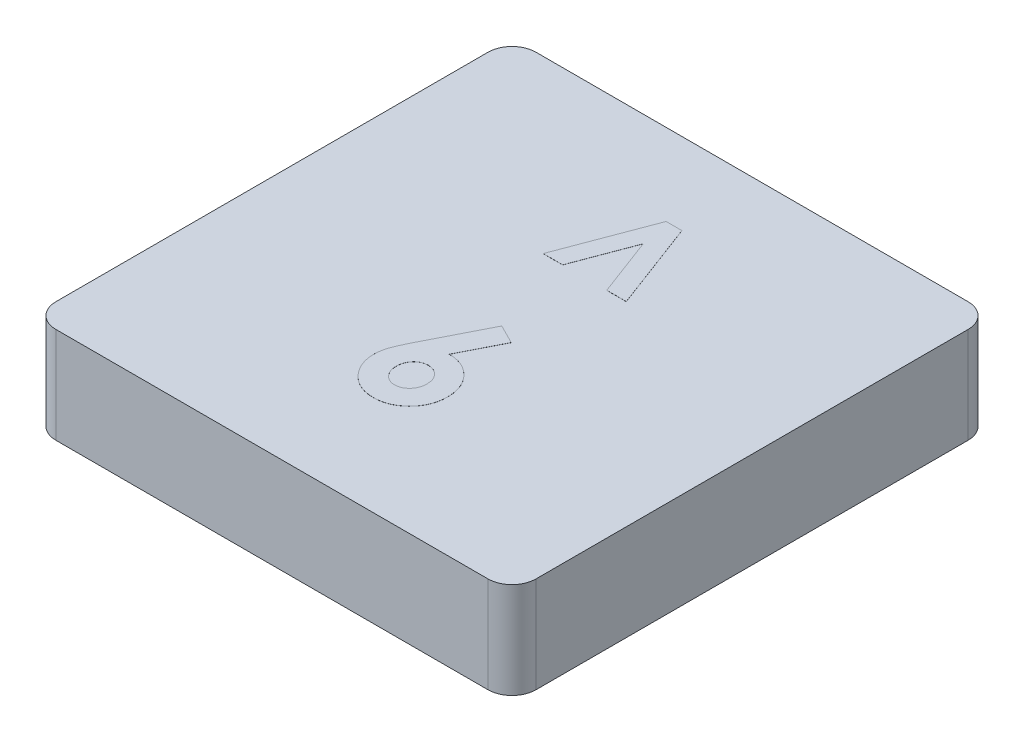
from build123d import *

# Parameters (mm, degrees)
SKETCH1_W           = 12.7
SKETCH1_H           = 12.7
BOSS_EXTRUDE1_DEPTH = 2.54
FILLET1_R           = 0.635
SHELL1_START        = 0.635
SHELL1_OUTLINE_W    = 1.905
SHELL1_OUTLINE_H    = 11.43
SHELL1_DEPTH        = 11.43
SKETCH2_R           = 2.54
BOSS_EXTRUDE2_DEPTH = 1.905
BOSS_EXTRUDE4_DEPTH = 0.00254


# Read off the part's stored shape, not the designer's step: Shell1
with BuildPart() as part:
    # Sketch1 → Boss-Extrude1 (new body)
    with BuildSketch(Plane(origin=(0, 0, 0), x_dir=(1, 0, 0), z_dir=(0, 1, 0))):
        with Locations((6.35, 6.35)):
            Rectangle(SKETCH1_W, SKETCH1_H)
    extrude(amount=BOSS_EXTRUDE1_DEPTH)

    # Fillet1
    fillet1_edges = [part.edges().sort_by_distance(p)[0] for p in [
        (0, 1.27, -12.7),
        (12.7, 1.27, -12.7),
        (12.7, 1.27, 0),
        (0, 1.27, 0),
    ]]
    fillet(fillet1_edges, radius=FILLET1_R)

    # Shell1 outline → Shell1 (cut)
    with BuildSketch(Plane.YZ.offset(SHELL1_START)):
        with Locations((0.9525, -6.35)):
            Rectangle(SHELL1_OUTLINE_W, SHELL1_OUTLINE_H)
    extrude(amount=SHELL1_DEPTH, mode=Mode.SUBTRACT)

    # Sketch2 → Boss-Extrude2 (add)
    with BuildSketch(Plane(origin=(0, 1.905, 0), x_dir=(-1, 0, 0), z_dir=(0, -1, 0))):
        with Locations(Location((-6.35, 6.35, 0), (0, 0, 270))):
            Circle(SKETCH2_R)
    extrude(amount=BOSS_EXTRUDE2_DEPTH)

    # Sketch4 → Boss-Extrude4 (add)
    # profile 1 of 2: a face of its own
    with BuildSketch(Plane(origin=(0, 2.54, 0), x_dir=(1, 0, 0), z_dir=(0, 1, 0))):
        with BuildLine():
            Line((6.456138622, 5.974210256), (6.960500601, 5.71853117))
            Line((6.960500601, 5.71853117), (6.407165264, 4.630941026))
            add(Edge.make_bspline(
                [(6.407165264, 4.630941026), (6.439855797, 4.630094651), (6.504245162, 4.628427578), (6.598981047, 4.614954014), (6.689550316, 4.591661453), (6.776866176, 4.560787227), (6.859861273, 4.519322834), (6.939872289, 4.469998775), (7.014829299, 4.40984278), (7.086451002, 4.34319313), (7.151576249, 4.269354895), (7.20814904, 4.190013367), (7.257451228, 4.107098934), (7.295776765, 4.018756598), (7.32669142, 3.926450736), (7.348997703, 3.82981236), (7.361724062, 3.728561626), (7.363478603, 3.659777417), (7.364371795, 3.624761138)],
                knots=[0, 0, 0, 0, 1.013260694, 1.995783107, 2.958651975, 3.908806537, 4.861209129, 5.829647963, 6.817170299, 7.835534541, 8.860094905, 9.863329007, 10.853101798, 11.844815043, 12.84250023, 13.867713965, 14.914507806, 16, 16, 16, 16], degree=3))
            add(Edge.make_bspline(
                [(7.364371795, 3.624761138), (7.3635348, 3.591007569), (7.361880421, 3.524291238), (7.348204784, 3.426301914), (7.326104237, 3.332286889), (7.294518118, 3.242433922), (7.254369605, 3.156303809), (7.205270694, 3.073947091), (7.146814203, 2.995979194), (7.080510488, 2.922814401), (7.008029089, 2.856124152), (6.931629747, 2.796845977), (6.850665063, 2.747879955), (6.766665364, 2.706527002), (6.678084165, 2.675668741), (6.586247088, 2.652376099), (6.490457705, 2.638935234), (6.425438326, 2.63724503), (6.392536859, 2.636389744)],
                knots=[0, 0, 0, 0, 1.049934834, 2.075270938, 3.072134561, 4.05064612, 5.033440221, 6.024524368, 7.028587226, 8.060776465, 9.092543989, 10.090062252, 11.064205434, 12.031961459, 12.998029633, 13.977230324, 14.976426867, 16, 16, 16, 16], degree=3))
            add(Edge.make_bspline(
                [(6.392536859, 2.636389744), (6.358131923, 2.637091632), (6.290479272, 2.6384718), (6.191486511, 2.653926046), (6.096543934, 2.677190259), (6.006185133, 2.710407602), (5.919848194, 2.752703587), (5.838549577, 2.805040616), (5.761604456, 2.866841549), (5.689833178, 2.936715965), (5.625172604, 3.013253826), (5.567500777, 3.092720054), (5.518710337, 3.175239347), (5.479215613, 3.260723478), (5.448400913, 3.348900047), (5.426960167, 3.439936406), (5.412989542, 3.53359108), (5.411351805, 3.597150442), (5.410525641, 3.629213261)],
                knots=[0, 0, 0, 0, 1.063775006, 2.091769615, 3.092589432, 4.084662827, 5.064601646, 6.061867366, 7.070035304, 8.113879863, 9.156342271, 10.166834137, 11.149076039, 12.117706134, 13.076241869, 14.034148791, 15.008317125, 16, 16, 16, 16], degree=3))
            add(Edge.make_bspline(
                [(5.410525641, 3.629213261), (5.41096217, 3.654042164), (5.411837658, 3.703838176), (5.420635786, 3.778404999), (5.434012031, 3.853167552), (5.449516851, 3.916254562), (5.465482147, 3.969601232), (5.481551341, 4.014747076), (5.501465566, 4.064849092), (5.524230475, 4.12003522), (5.550561942, 4.180239071), (5.580322415, 4.245296544), (5.613585986, 4.315700304), (5.637307493, 4.364056786), (5.649668269, 4.389254327)],
                knots=[0, 0, 0, 0, 1.110454016, 2.227089276, 3.35462975, 4.507227546, 5.131400587, 5.845402449, 6.650387134, 7.543487832, 8.516250726, 9.590168902, 10.744287919, 12, 12, 12, 12], degree=3))
            Line((5.649668269, 4.389254327), (6.456138622, 5.974210256))
        make_face()
        with BuildLine():
            add(Edge.make_bspline(
                [(6.379816506, 4.101774359), (6.352472323, 4.100520139), (6.298963346, 4.098065795), (6.222881583, 4.072362713), (6.153512277, 4.032040974), (6.093382105, 3.975885155), (6.043088748, 3.908776745), (6.006131425, 3.832230641), (5.983899541, 3.747268327), (5.981589791, 3.687864094), (5.980397436, 3.657198037)],
                knots=[0, 0, 0, 0, 0.981744412, 1.921144944, 2.858899012, 3.85339082, 4.86292663, 5.863643845, 6.897155691, 8, 8, 8, 8], degree=3))
            add(Edge.make_bspline(
                [(5.980397436, 3.657198037), (5.981809222, 3.626521768), (5.984555239, 3.566854373), (6.007623071, 3.481083067), (6.045392269, 3.402798689), (6.098361161, 3.334800948), (6.160545878, 3.278357558), (6.229501354, 3.236614972), (6.304077387, 3.210971132), (6.35566345, 3.207842243), (6.381724559, 3.206261538)],
                knots=[0, 0, 0, 0, 1.098279937, 2.136227893, 3.159405121, 4.194678092, 5.206500211, 6.154139736, 7.067477469, 8, 8, 8, 8], degree=3))
            add(Edge.make_bspline(
                [(6.381724559, 3.206261538), (6.409248036, 3.207870396), (6.463226355, 3.211025646), (6.54109362, 3.23559044), (6.612225834, 3.276633701), (6.67512047, 3.332896382), (6.729145767, 3.400118178), (6.766525816, 3.478862388), (6.790660084, 3.565252761), (6.79319133, 3.625862449), (6.7945, 3.657198037)],
                knots=[0, 0, 0, 0, 0.96921794, 1.900804717, 2.848419905, 3.844199796, 4.861108892, 5.867439427, 6.897452859, 8, 8, 8, 8], degree=3))
            add(Edge.make_bspline(
                [(6.7945, 3.657198037), (6.793009186, 3.687846189), (6.79012205, 3.747199913), (6.768436237, 3.832560256), (6.729717682, 3.908811323), (6.678286397, 3.976162168), (6.616086864, 4.032292947), (6.543941256, 4.072680703), (6.464383952, 4.098020258), (6.408416654, 4.100504747), (6.379816506, 4.101774359)],
                knots=[0, 0, 0, 0, 1.083229974, 2.097801324, 3.086792542, 4.086858909, 5.079819718, 6.026392613, 6.991456328, 8, 8, 8, 8], degree=3))
        make_face(mode=Mode.SUBTRACT)
    # profile 2 of 2: a face of its own
    with BuildSketch(Plane(origin=(0, 2.54, 0), x_dir=(1, 0, 0), z_dir=(0, 1, 0))):
        Polygon((6.235008013, 10.541), (6.653507612, 10.541), (7.542660256, 8.180102564), (7.026213942, 8.180102564), (6.443621795, 9.726897436), (5.86039363, 8.180102564), (5.344583333, 8.180102564), align=None)
    extrude(amount=BOSS_EXTRUDE4_DEPTH)


solid = part.part
